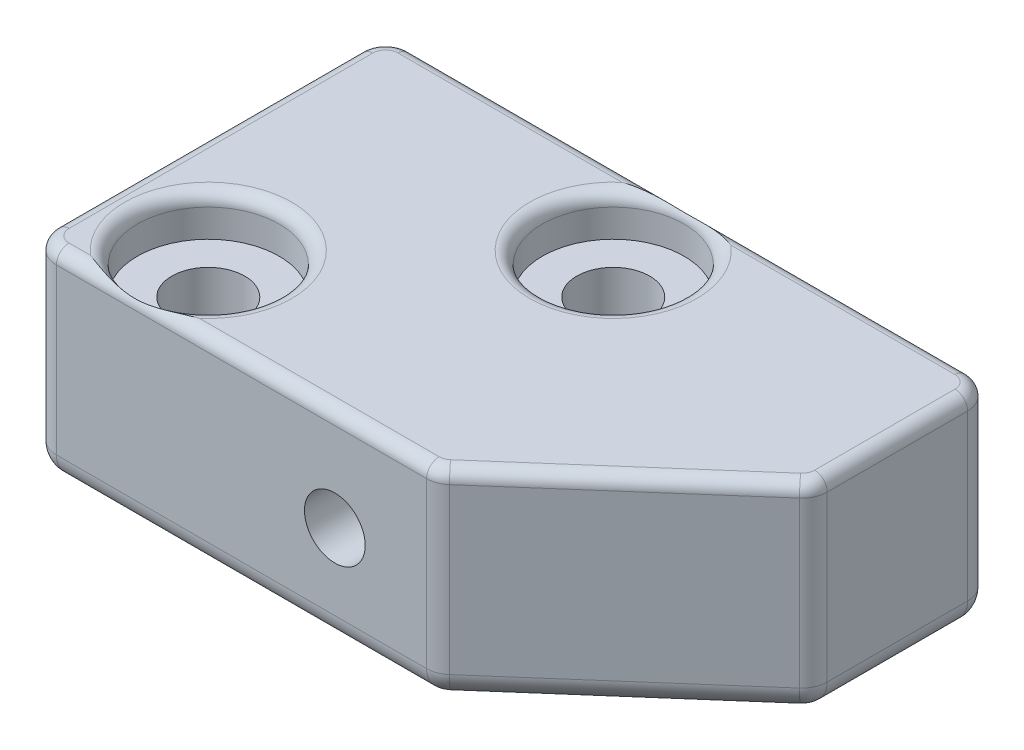
from build123d import *

# Parameters (mm, degrees)
BOSS_EXTRUDE1_DEPTH = 12.7
SKETCH2_R           = 2.286
CUT_EXTRUDE1_DEPTH  = 32.908355097
SKETCH3_R           = 4.445
CUT_EXTRUDE2_DEPTH  = 2.54
SKETCH4_R           = 1.905
CUT_EXTRUDE3_DEPTH  = 12.7
SKETCH5_R           = 1.905
CUT_EXTRUDE4_DEPTH  = 12.7
FILLET1_R           = 1.5875
FILLET2_R           = 0.79375


with BuildPart() as part:
    # Sketch1 → Boss-Extrude1 (new body)
    with BuildSketch(Plane(origin=(0, 0, 0), x_dir=(1, 0, 0), z_dir=(0, 1, 0))):
        Polygon((-19.05, 0), (19.05, 0), (19.05, -11.1125), (6.35, -22.225), (-19.05, -22.225), align=None)
    extrude(amount=BOSS_EXTRUDE1_DEPTH)

    # Sketch2 → Cut-Extrude1 (cut, through all)
    with BuildSketch(Plane(origin=(0, 12.7, 0), x_dir=(1, 0, 0), z_dir=(0, 1, 0))):
        with Locations(Location((0, -4.7625, 0), (0, 0, 270))):
            Circle(SKETCH2_R)
        with Locations(Location((-12.7, -17.4625, 0), (0, 0, 270))):
            Circle(SKETCH2_R)
    extrude(amount=-CUT_EXTRUDE1_DEPTH, mode=Mode.SUBTRACT)

    # Sketch3 → Cut-Extrude2 (cut)
    with BuildSketch(Plane(origin=(0, 12.7, 0), x_dir=(1, 0, 0), z_dir=(0, 1, 0))):
        with Locations(Location((0, -4.7625, 0), (0, 0, 270))):
            Circle(SKETCH3_R)
        with Locations(Location((-12.7, -17.4625, 0), (0, 0, 270))):
            Circle(SKETCH3_R)
    extrude(amount=-CUT_EXTRUDE2_DEPTH, mode=Mode.SUBTRACT)

    # Sketch4 → Cut-Extrude3 (cut)
    with BuildSketch(Plane(origin=(0, 0, 0), x_dir=(-1, 0, 0), z_dir=(0, 0, -1))):
        with Locations((-12.7, 6.35)):
            Circle(SKETCH4_R)
        with Locations((12.7, 6.35)):
            Circle(SKETCH4_R)
    extrude(amount=-CUT_EXTRUDE3_DEPTH, mode=Mode.SUBTRACT)

    # Sketch5 → Cut-Extrude4 (cut)
    with BuildSketch(Plane.XY.offset(22.225)):
        with Locations((0, 6.35)):
            Circle(SKETCH5_R)
    extrude(amount=-CUT_EXTRUDE4_DEPTH, mode=Mode.SUBTRACT)

    # Fillet1
    fillet1_edges = [part.edges().sort_by_distance(p)[0] for p in [
        (-19.05, 0, 11.1125),
        (0, 0, 0),
        (19.05, 0, 5.55625),
        (12.7, 0, 16.66875),
        (-6.35, 0, 22.225),
        (-19.05, 6.35, 22.225),
        (-19.05, 6.35, 0),
        (19.05, 6.35, 0),
        (19.05, 6.35, 11.1125),
        (6.35, 6.35, 22.225),
    ]]
    fillet(fillet1_edges, radius=FILLET1_R)

    # Fillet2
    # the kernel refuses this fillet: 0.79375 mm, written as the material it takes off along each edge
    with BuildSketch(Plane(origin=(0, 12.7, 4.7625), x_dir=(0, 0, 1), z_dir=(-1, 0, 0))) as fillet2_piece_1:
        with BuildLine():
            CenterArc((4.445 + FILLET2_R, -FILLET2_R), FILLET2_R, 90, 90)
            Line((4.445, -FILLET2_R), (4.445, 0))
            Line((4.445, 0), (4.445 + FILLET2_R, 0))
        make_face()
    revolve(axis=Axis((0, 12.7, 4.7625), (0, 1, 0)), mode=Mode.SUBTRACT)
    with BuildSketch(Plane(origin=(-12.7, 12.7, 17.4625), x_dir=(0, 0, 1), z_dir=(-1, 0, 0))) as fillet2_piece_2:
        with BuildLine():
            CenterArc((4.445 + FILLET2_R, -FILLET2_R), FILLET2_R, 90, 90)
            Line((4.445, -FILLET2_R), (4.445, 0))
            Line((4.445, 0), (4.445 + FILLET2_R, 0))
        make_face()
    revolve(axis=Axis((-12.7, 12.7, 17.4625), (0, 1, 0)), mode=Mode.SUBTRACT)
    with BuildSketch(Plane(origin=(-17.4625, 12.7, 0), x_dir=(0, -1, 0), z_dir=(1, 0, 0))) as fillet2_piece_3:
        with BuildLine():
            CenterArc((FILLET2_R, -FILLET2_R), FILLET2_R, 90, 90)
            Line((0, -FILLET2_R), (0, 0))
            Line((0, 0), (FILLET2_R, 0))
        make_face()
    extrude(amount=34.925, mode=Mode.SUBTRACT)
    with BuildSketch(Plane(origin=(19.05, 12.7, 1.5875), x_dir=(-1, 0, 0), z_dir=(0, 0, 1))) as fillet2_piece_4:
        with BuildLine():
            CenterArc((FILLET2_R, FILLET2_R), FILLET2_R, 180, 90)
            Line((0, FILLET2_R), (0, 0))
            Line((0, 0), (FILLET2_R, 0))
        make_face()
    extrude(amount=8.80464294, mode=Mode.SUBTRACT)
    with BuildSketch(Plane(origin=(5.753520503, 12.7, 22.225), x_dir=(0, 0, -1), z_dir=(-1, 0, 0))) as fillet2_piece_5:
        with BuildLine():
            CenterArc((FILLET2_R, FILLET2_R), FILLET2_R, 180, 90)
            Line((0, FILLET2_R), (0, 0))
            Line((0, 0), (FILLET2_R, 0))
        make_face()
    extrude(amount=23.216020503, mode=Mode.SUBTRACT)
    with BuildSketch(Plane(origin=(18.507876065, 12.7, 11.586858443), x_dir=(-0.6585046078685184, 0, -0.7525766947068776), z_dir=(-0.7525766947068777, 0, 0.6585046078685184))) as fillet2_piece_6:
        with BuildLine():
            CenterArc((FILLET2_R, FILLET2_R), FILLET2_R, 180, 90)
            Line((0, FILLET2_R), (0, 0))
            Line((0, 0), (FILLET2_R, 0))
        make_face()
    extrude(amount=15.558519921, mode=Mode.SUBTRACT)
    with BuildSketch(Plane(origin=(-19.05, 12.7, 20.6375), x_dir=(1, 0, 0), z_dir=(0, 0, -1))) as fillet2_piece_7:
        with BuildLine():
            CenterArc((FILLET2_R, FILLET2_R), FILLET2_R, 180, 90)
            Line((0, FILLET2_R), (0, 0))
            Line((0, 0), (FILLET2_R, 0))
        make_face()
    extrude(amount=19.05, mode=Mode.SUBTRACT)
    with BuildSketch(Plane(origin=(-17.4625, 12.7, 20.6375), x_dir=(-1, 0, 0), z_dir=(0, 0, -1))) as fillet2_piece_8:
        with BuildLine():
            CenterArc((1.5875 - FILLET2_R, -FILLET2_R), FILLET2_R, 0, 90)
            Line((1.5875, -FILLET2_R), (1.5875, 0))
            Line((1.5875, 0), (1.5875 - FILLET2_R, 0))
        make_face()
    revolve(axis=Axis((-17.4625, 12.7, 20.6375), (0, 1, 0)), revolution_arc=90, mode=Mode.SUBTRACT)
    with BuildSketch(Plane(origin=(-17.4625, 12.7, 1.5875), x_dir=(0, 0, -1), z_dir=(1, 0, 0))) as fillet2_piece_9:
        with BuildLine():
            CenterArc((1.5875 - FILLET2_R, -FILLET2_R), FILLET2_R, 0, 90)
            Line((1.5875, -FILLET2_R), (1.5875, 0))
            Line((1.5875, 0), (1.5875 - FILLET2_R, 0))
        make_face()
    revolve(axis=Axis((-17.4625, 12.7, 1.5875), (0, 1, 0)), revolution_arc=90, mode=Mode.SUBTRACT)
    with BuildSketch(Plane(origin=(5.753520503, 12.7, 20.6375), x_dir=(0, 0, 1), z_dir=(-1, 0, 0))) as fillet2_piece_10:
        with BuildLine():
            CenterArc((1.5875 - FILLET2_R, -FILLET2_R), FILLET2_R, 0, 90)
            Line((1.5875, -FILLET2_R), (1.5875, 0))
            Line((1.5875, 0), (1.5875 - FILLET2_R, 0))
        make_face()
    revolve(axis=Axis((5.753520503, 12.7, 20.6375), (0, 1, 0)), revolution_arc=41.185925166, mode=Mode.SUBTRACT)
    with BuildSketch(Plane(origin=(17.4625, 12.7, 10.39214294), x_dir=(1, 0, 0), z_dir=(0, 0, -1))) as fillet2_piece_11:
        with BuildLine():
            CenterArc((1.5875 - FILLET2_R, FILLET2_R), FILLET2_R, 270, 90)
            Line((1.5875, FILLET2_R), (1.5875, 0))
            Line((1.5875, 0), (1.5875 - FILLET2_R, 0))
        make_face()
    revolve(axis=Axis((17.4625, 12.7, 10.39214294), (0, -1, 0)), revolution_arc=48.814074834, mode=Mode.SUBTRACT)
    with BuildSketch(Plane(origin=(17.4625, 12.7, 1.5875), x_dir=(0, 0, -1), z_dir=(-1, 0, 0))) as fillet2_piece_12:
        with BuildLine():
            CenterArc((1.5875 - FILLET2_R, FILLET2_R), FILLET2_R, 270, 90)
            Line((1.5875, FILLET2_R), (1.5875, 0))
            Line((1.5875, 0), (1.5875 - FILLET2_R, 0))
        make_face()
    revolve(axis=Axis((17.4625, 12.7, 1.5875), (0, -1, 0)), revolution_arc=90, mode=Mode.SUBTRACT)


solid = part.part
